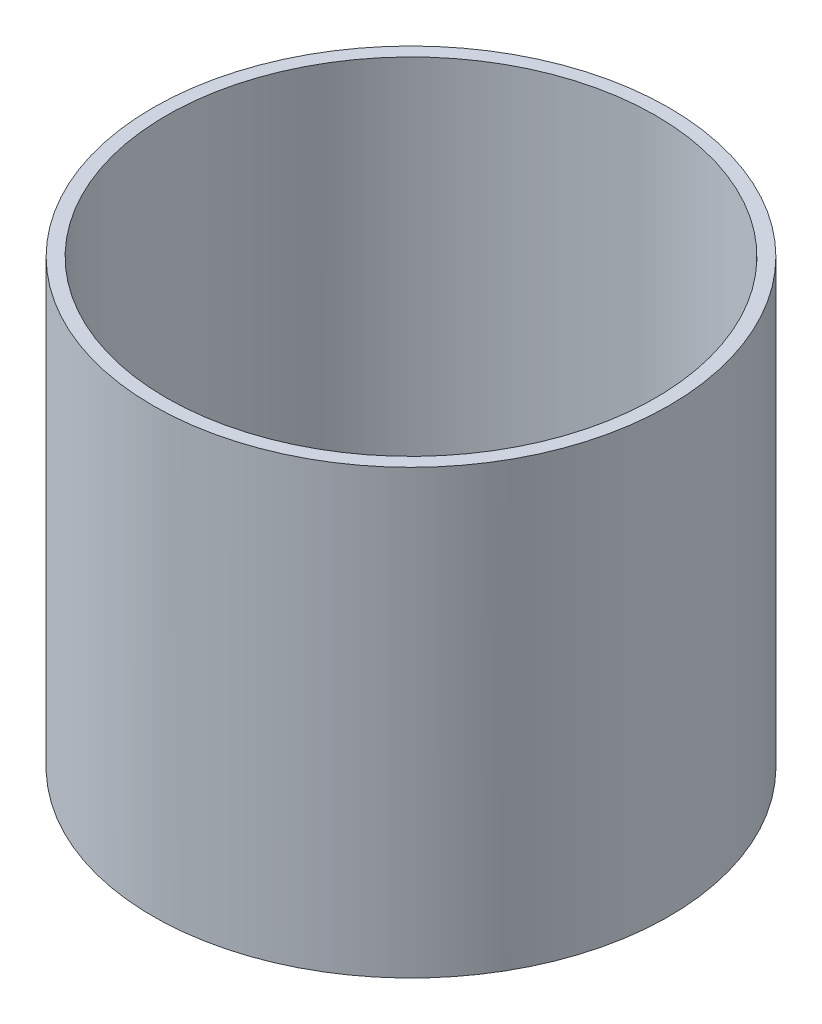
from build123d import *

# Parameters (mm, degrees)
SKETCH_1_R               = 38.5
SKETCH_1_R_2             = 36.5
EXTRUDE_1_DEPTH          = 73
EXTRUDE_3_DEPTH          = 1.6
PATTERN_CIRCULAR_1_COUNT = 3
SKETCH_3_R               = 52.927820275
CUT_EXTRUDE_1_DEPTH      = 7


with BuildPart() as part:
    # Эскиз1 → Бобышка-Вытянуть1 (new body)
    with BuildSketch(Plane(origin=(0, 0, 0), x_dir=(1, 0, 0), z_dir=(0, 1, 0))):
        Circle(SKETCH_1_R)
        Circle(SKETCH_1_R_2, mode=Mode.SUBTRACT)
    extrude(amount=EXTRUDE_1_DEPTH)

    # Эскиз2 → Бобышка-Вытянуть3 (add)
    with BuildSketch(Plane.XY.offset(36.5)):
        Polygon((1.95, 20.447072268), (-0.95, 20.447072268), (-2.05, 20.447072268), (-2.05, 9), (1.95, 9), align=None)
    extrude_3 = extrude(amount=-EXTRUDE_3_DEPTH)

    # Круговой массив1: Бобышка-Вытянуть3 ×3 about axis
    pattern_circular_1_axis = Axis((0, 73, 0), (0, -1, 0))
    for i in range(1, PATTERN_CIRCULAR_1_COUNT):
        add(extrude_3.rotate(pattern_circular_1_axis, i * 360 / PATTERN_CIRCULAR_1_COUNT))

    # Эскиз3 → Вырез-Вытянуть1 (cut)
    with BuildSketch(Plane.XZ):
        Circle(SKETCH_3_R)
    extrude(amount=-CUT_EXTRUDE_1_DEPTH, mode=Mode.SUBTRACT)


solid = part.part
